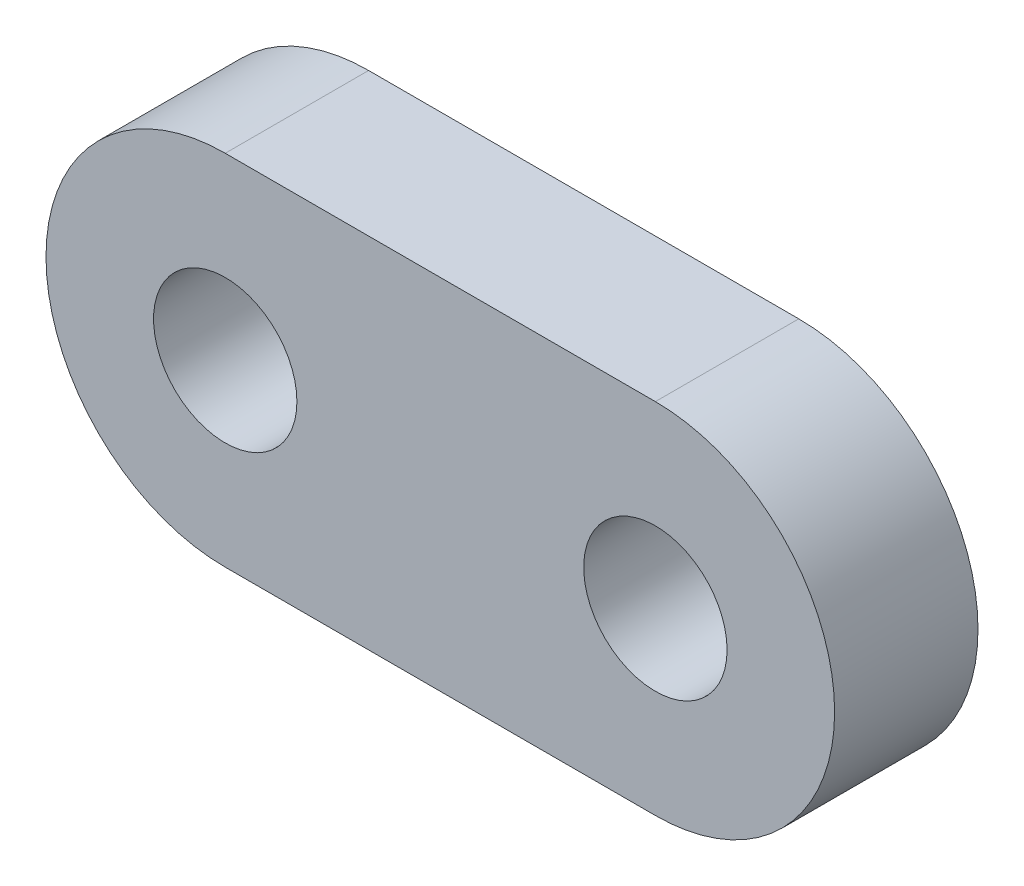
from build123d import *

# Parameters (mm, degrees)
SKETCH1_R           = 1.27
BOSS_EXTRUDE1_DEPTH = 2.54


with BuildPart() as part:
    # Sketch1 → Boss-Extrude1 (new body)
    with BuildSketch(Plane.XY):
        with BuildLine():
            Line((7.62, 3.175), (0, 3.175))
            ThreePointArc((0, 3.175), (-3.175, 0), (0, -3.175))
            Line((0, -3.175), (7.62, -3.175))
            ThreePointArc((7.62, -3.175), (10.795, 0), (7.62, 3.175))
        make_face()
        with Locations((7.62, 0)):
            Circle(SKETCH1_R, mode=Mode.SUBTRACT)
        Circle(SKETCH1_R, mode=Mode.SUBTRACT)
    extrude(amount=BOSS_EXTRUDE1_DEPTH)


solid = part.part
